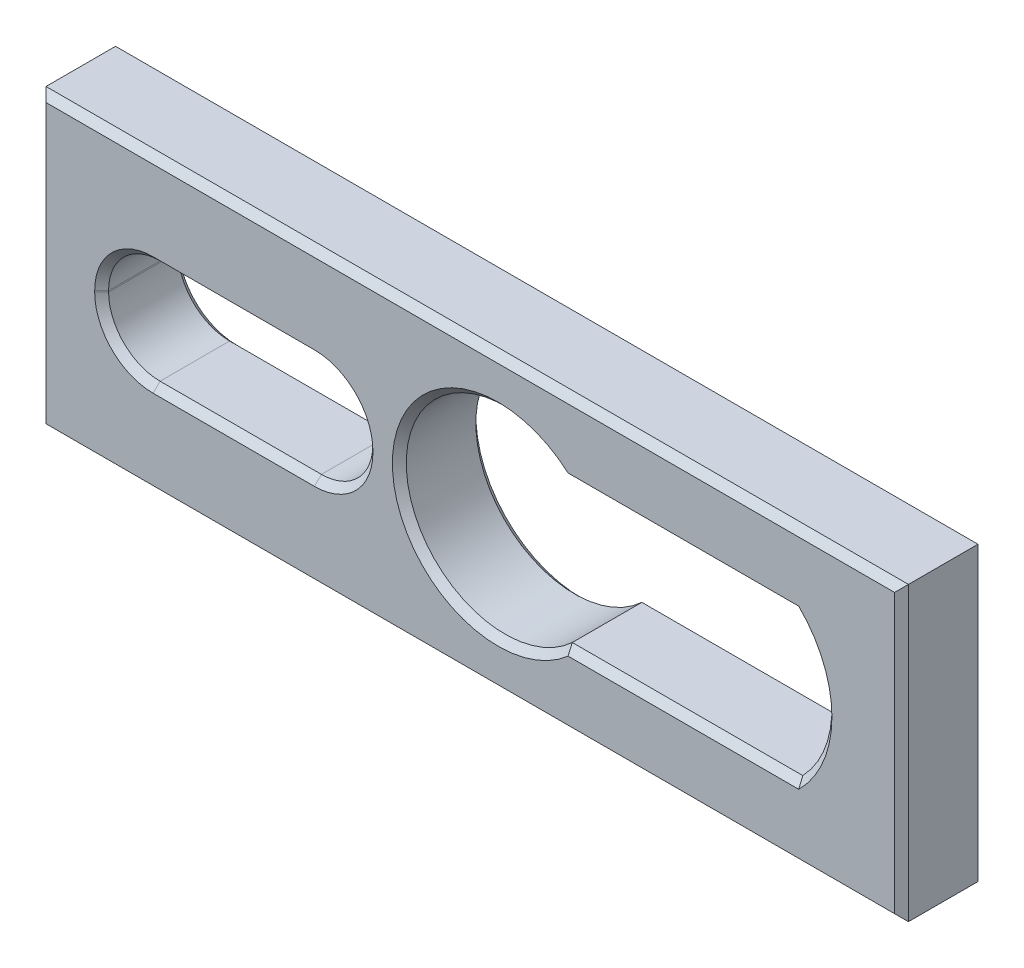
from build123d import *

# Parameters (mm, degrees)
SKETCH_1_W          = 62
SKETCH_1_H          = 21
EXTRUDE_1_DEPTH     = 6
SKETCH_2_R          = 7.1
CUT_EXTRUDE_1_DEPTH = 6
CUT_EXTRUDE_2_DEPTH = 6
CHAMFER_1_SIZE      = 0.5


with BuildPart() as part:
    # Эскиз1 → Бобышка-Вытянуть1 (new body)
    with BuildSketch(Plane.XY):
        Rectangle(SKETCH_1_W, SKETCH_1_H)
    extrude(amount=EXTRUDE_1_DEPTH)

    # Эскиз2 → Вырез-Вытянуть1 (cut)
    with BuildSketch(Plane.XY.offset(6)):
        with Locations((2, 0)):
            Circle(SKETCH_2_R)
        with BuildLine():
            Line((-22.8, 3.75), (-11.2, 3.75))
            ThreePointArc((-11.2, 3.75), (-8.58370491, 2.66629509), (-7.5, 0.05))
            Line((-7.5, 0.05), (-7.5, -0.05))
            ThreePointArc((-7.5, -0.05), (-8.58370491, -2.66629509), (-11.2, -3.75))
            Line((-11.2, -3.75), (-22.8, -3.75))
            ThreePointArc((-22.8, -3.75), (-25.41629509, -2.66629509), (-26.5, -0.05))
            Line((-26.5, -0.05), (-26.5, 0.05))
            ThreePointArc((-26.5, 0.05), (-25.41629509, 2.66629509), (-22.8, 3.75))
        make_face()
    extrude(amount=-CUT_EXTRUDE_1_DEPTH, mode=Mode.SUBTRACT)

    # Эскиз3 → Вырез-Вытянуть2 (cut)
    with BuildSketch(Plane.XY.offset(6)):
        with BuildLine():
            Line((23.404627647, 5.2), (4.5, 5.2))
            Line((4.5, 5.2), (4.5, -5.2))
            Line((4.5, -5.2), (23.404627647, -5.2))
            ThreePointArc((23.404627647, -5.2), (25.5, 0), (23.404627647, 5.2))
        make_face()
    extrude(amount=-CUT_EXTRUDE_2_DEPTH, mode=Mode.SUBTRACT)

    # Фаска1
    chamfer_1_edges = [part.edges().sort_by_distance(p)[0] for p in [
        (0, 10.5, 0),
    ]]
    chamfer(chamfer_1_edges, length=CHAMFER_1_SIZE)
    chamfer_1_2_edges = [part.edges().sort_by_distance(p)[0] for p in [
        (0, 10.5, 6),
    ]]
    chamfer(chamfer_1_2_edges, length=CHAMFER_1_SIZE)
    chamfer_1_3_edges = [part.edges().sort_by_distance(p)[0] for p in [
        (-31, -0.25, 0),
    ]]
    chamfer(chamfer_1_3_edges, length=CHAMFER_1_SIZE)
    chamfer_1_4_edges = [part.edges().sort_by_distance(p)[0] for p in [
        (-31, -0.25, 6),
    ]]
    chamfer(chamfer_1_4_edges, length=CHAMFER_1_SIZE)
    chamfer_1_5_edges = [part.edges().sort_by_distance(p)[0] for p in [
        (31, -0.25, 0),
    ]]
    chamfer(chamfer_1_5_edges, length=CHAMFER_1_SIZE)
    chamfer_1_6_edges = [part.edges().sort_by_distance(p)[0] for p in [
        (31, -0.25, 6),
    ]]
    chamfer(chamfer_1_6_edges, length=CHAMFER_1_SIZE)
    chamfer_1_7_edges = [part.edges().sort_by_distance(p)[0] for p in [
        (0, -10.5, 0),
    ]]
    chamfer(chamfer_1_7_edges, length=CHAMFER_1_SIZE)
    chamfer_1_8_edges = [part.edges().sort_by_distance(p)[0] for p in [
        (15.119440216, 5.2, 0),
    ]]
    chamfer(chamfer_1_8_edges, length=CHAMFER_1_SIZE)
    chamfer_1_9_edges = [part.edges().sort_by_distance(p)[0] for p in [
        (25.5, 0, 0),
    ]]
    chamfer(chamfer_1_9_edges, length=CHAMFER_1_SIZE)
    chamfer_1_10_edges = [part.edges().sort_by_distance(p)[0] for p in [
        (15.119440216, -5.2, 0),
    ]]
    chamfer(chamfer_1_10_edges, length=CHAMFER_1_SIZE)
    chamfer_1_11_edges = [part.edges().sort_by_distance(p)[0] for p in [
        (-5.1, 0, 0),
    ]]
    chamfer(chamfer_1_11_edges, length=CHAMFER_1_SIZE)
    chamfer_1_12_edges = [part.edges().sort_by_distance(p)[0] for p in [
        (-17, 3.75, 0),
        (-25.41629509, 2.66629509, 0),
        (-8.58370491, 2.66629509, 0),
        (-26.5, 0, 0),
        (-7.5, 0, 0),
        (-25.41629509, -2.66629509, 0),
        (-8.58370491, -2.66629509, 0),
        (-17, -3.75, 0),
    ]]
    chamfer(chamfer_1_12_edges, length=CHAMFER_1_SIZE)
    chamfer_1_13_edges = [part.edges().sort_by_distance(p)[0] for p in [
        (0, -10.5, 6),
    ]]
    chamfer(chamfer_1_13_edges, length=CHAMFER_1_SIZE)
    chamfer_1_14_edges = [part.edges().sort_by_distance(p)[0] for p in [
        (15.119440216, 5.2, 6),
    ]]
    chamfer(chamfer_1_14_edges, length=CHAMFER_1_SIZE)
    chamfer_1_15_edges = [part.edges().sort_by_distance(p)[0] for p in [
        (25.5, 0, 6),
    ]]
    chamfer(chamfer_1_15_edges, length=CHAMFER_1_SIZE)
    chamfer_1_16_edges = [part.edges().sort_by_distance(p)[0] for p in [
        (15.119440216, -5.2, 6),
    ]]
    chamfer(chamfer_1_16_edges, length=CHAMFER_1_SIZE)
    chamfer_1_17_edges = [part.edges().sort_by_distance(p)[0] for p in [
        (-5.1, 0, 6),
    ]]
    chamfer(chamfer_1_17_edges, length=CHAMFER_1_SIZE)
    chamfer_1_18_edges = [part.edges().sort_by_distance(p)[0] for p in [
        (-17, 3.75, 6),
        (-25.41629509, 2.66629509, 6),
        (-8.58370491, 2.66629509, 6),
        (-26.5, 0, 6),
        (-7.5, 0, 6),
        (-25.41629509, -2.66629509, 6),
        (-8.58370491, -2.66629509, 6),
        (-17, -3.75, 6),
    ]]
    chamfer(chamfer_1_18_edges, length=CHAMFER_1_SIZE)


solid = part.part
